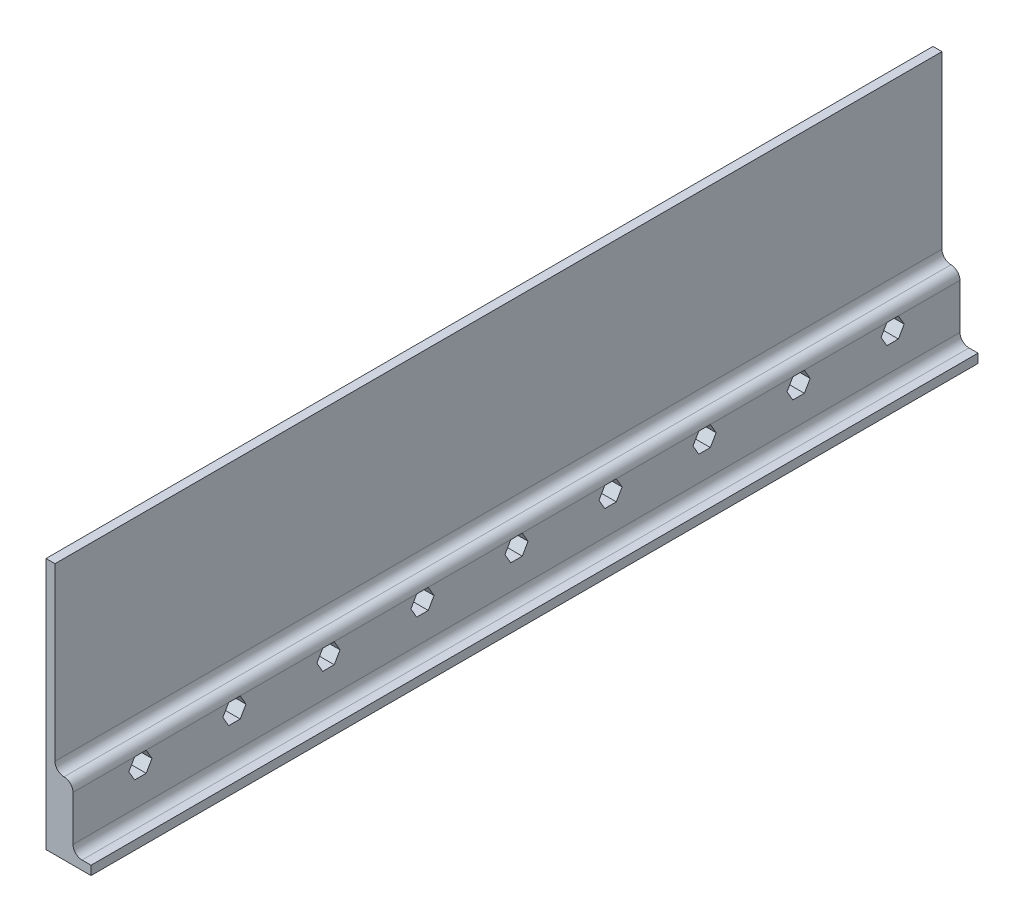
from build123d import *

# Parameters (mm, degrees)
GENERAL_EXTRUDE_DEPTH       = 925
ROUNDING_R                  = 5
ROLLER_HOLDERS_DEPTH        = 926.55388822
SKETCH5_W                   = 5
SKETCH5_H                   = 1850
GUARD_RAIL_DEPTH            = 100
GUARD_RAIL_SUPPORT_FILLET_R = 5
CUT_TO_SIZE_DEPTH           = 934.086276825
CUT_TO_SIZE_DEPTH_BACK      = 934.086276825
SKETCH6_W                   = 1357.48
SKETCH6_H                   = 140


with BuildPart() as part:
    # Sketch2 → General extrude (new, symmetric)
    with BuildSketch(Plane.XY):
        Polygon((-12.5, 20), (-12.5, -20), (12.5, -20), (12.5, -15), (2.5, -15), (2.5, 20), align=None)
    extrude(amount=GENERAL_EXTRUDE_DEPTH, both=True)

    # Rounding
    rounding_edges = [part.edges().sort_by_distance(p)[0] for p in [
        (2.5, 20, 0),
        (2.5, -15, 0),
    ]]
    fillet(rounding_edges, radius=ROUNDING_R)

    # Sketch3 → Roller holders (cut, through all)
    with BuildSketch(Plane.ZY.offset(12.5)):
        Polygon((-884.3762927, 3.8875), (-881.168390267, 9.44375), (-884.3762927, 15), (-890.792097567, 15), (-894, 9.44375), (-890.792097567, 3.8875), align=None)
        Polygon((-832.165457693, 3.8875), (-828.957555259, 9.44375), (-832.165457693, 15), (-838.581262559, 15), (-841.789164992, 9.44375), (-838.581262559, 3.8875), align=None)
        Polygon((-779.954622685, 3.8875), (-776.746720252, 9.44375), (-779.954622685, 15), (-786.370427551, 15), (-789.578329984, 9.44375), (-786.370427551, 3.8875), align=None)
        Polygon((-727.743787677, 3.8875), (-724.535885244, 9.44375), (-727.743787677, 15), (-734.159592543, 15), (-737.367494976, 9.44375), (-734.159592543, 3.8875), align=None)
        Polygon((-675.532952669, 3.8875), (-672.325050236, 9.44375), (-675.532952669, 15), (-681.948757535, 15), (-685.156659969, 9.44375), (-681.948757535, 3.8875), align=None)
        Polygon((-623.322117661, 3.8875), (-620.114215228, 9.44375), (-623.322117661, 15), (-629.737922528, 15), (-632.945824961, 9.44375), (-629.737922528, 3.8875), align=None)
        Polygon((-571.111282653, 3.8875), (-567.90338022, 9.44375), (-571.111282653, 15), (-577.52708752, 15), (-580.734989953, 9.44375), (-577.52708752, 3.8875), align=None)
        Polygon((-518.900447645, 3.8875), (-515.692545212, 9.44375), (-518.900447645, 15), (-525.316252512, 15), (-528.524154945, 9.44375), (-525.316252512, 3.8875), align=None)
        Polygon((-466.689612638, 3.8875), (-463.481710204, 9.44375), (-466.689612638, 15), (-473.105417504, 15), (-476.313319937, 9.44375), (-473.105417504, 3.8875), align=None)
        Polygon((-414.47877763, 3.8875), (-411.270875197, 9.44375), (-414.47877763, 15), (-420.894582496, 15), (-424.102484929, 9.44375), (-420.894582496, 3.8875), align=None)
        Polygon((-362.267942622, 3.8875), (-359.060040189, 9.44375), (-362.267942622, 15), (-368.683747488, 15), (-371.891649921, 9.44375), (-368.683747488, 3.8875), align=None)
        Polygon((-310.057107614, 3.8875), (-306.849205181, 9.44375), (-310.057107614, 15), (-316.47291248, 15), (-319.680814914, 9.44375), (-316.47291248, 3.8875), align=None)
        Polygon((-257.846272606, 3.8875), (-254.638370173, 9.44375), (-257.846272606, 15), (-264.262077472, 15), (-267.469979906, 9.44375), (-264.262077472, 3.8875), align=None)
        Polygon((-205.635437598, 3.8875), (-202.427535165, 9.44375), (-205.635437598, 15), (-212.051242465, 15), (-215.259144898, 9.44375), (-212.051242465, 3.8875), align=None)
        Polygon((-153.42460259, 3.8875), (-150.216700157, 9.44375), (-153.42460259, 15), (-159.840407457, 15), (-163.04830989, 9.44375), (-159.840407457, 3.8875), align=None)
        Polygon((-101.213767583, 3.8875), (-98.005865149, 9.44375), (-101.213767583, 15), (-107.629572449, 15), (-110.837474882, 9.44375), (-107.629572449, 3.8875), align=None)
        Polygon((-49.002932575, 3.8875), (-45.795030141, 9.44375), (-49.002932575, 15), (-55.418737441, 15), (-58.626639874, 9.44375), (-55.418737441, 3.8875), align=None)
        Polygon((3.207902433, 3.8875), (6.415804866, 9.44375), (3.207902433, 15), (-3.207902433, 15), (-6.415804866, 9.44375), (-3.207902433, 3.8875), align=None)
        Polygon((55.418737441, 3.8875), (58.626639874, 9.44375), (55.418737441, 15), (49.002932575, 15), (45.795030141, 9.44375), (49.002932575, 3.8875), align=None)
        Polygon((107.629572449, 3.8875), (110.837474882, 9.44375), (107.629572449, 15), (101.213767583, 15), (98.005865149, 9.44375), (101.213767583, 3.8875), align=None)
        Polygon((159.840407457, 3.8875), (163.04830989, 9.44375), (159.840407457, 15), (153.42460259, 15), (150.216700157, 9.44375), (153.42460259, 3.8875), align=None)
        Polygon((212.051242465, 3.8875), (215.259144898, 9.44375), (212.051242465, 15), (205.635437598, 15), (202.427535165, 9.44375), (205.635437598, 3.8875), align=None)
        Polygon((264.262077472, 3.8875), (267.469979906, 9.44375), (264.262077472, 15), (257.846272606, 15), (254.638370173, 9.44375), (257.846272606, 3.8875), align=None)
        Polygon((316.47291248, 3.8875), (319.680814914, 9.44375), (316.47291248, 15), (310.057107614, 15), (306.849205181, 9.44375), (310.057107614, 3.8875), align=None)
        Polygon((368.683747488, 3.8875), (371.891649921, 9.44375), (368.683747488, 15), (362.267942622, 15), (359.060040189, 9.44375), (362.267942622, 3.8875), align=None)
        Polygon((420.894582496, 3.8875), (424.102484929, 9.44375), (420.894582496, 15), (414.47877763, 15), (411.270875197, 9.44375), (414.47877763, 3.8875), align=None)
        Polygon((473.105417504, 3.8875), (476.313319937, 9.44375), (473.105417504, 15), (466.689612638, 15), (463.481710204, 9.44375), (466.689612638, 3.8875), align=None)
        Polygon((525.316252512, 3.8875), (528.524154945, 9.44375), (525.316252512, 15), (518.900447645, 15), (515.692545212, 9.44375), (518.900447645, 3.8875), align=None)
        Polygon((577.52708752, 3.8875), (580.734989953, 9.44375), (577.52708752, 15), (571.111282653, 15), (567.90338022, 9.44375), (571.111282653, 3.8875), align=None)
        Polygon((629.737922528, 3.8875), (632.945824961, 9.44375), (629.737922528, 15), (623.322117661, 15), (620.114215228, 9.44375), (623.322117661, 3.8875), align=None)
        Polygon((681.948757535, 3.8875), (685.156659969, 9.44375), (681.948757535, 15), (675.532952669, 15), (672.325050236, 9.44375), (675.532952669, 3.8875), align=None)
        Polygon((734.159592543, 3.8875), (737.367494976, 9.44375), (734.159592543, 15), (727.743787677, 15), (724.535885244, 9.44375), (727.743787677, 3.8875), align=None)
        Polygon((786.370427551, 3.8875), (789.578329984, 9.44375), (786.370427551, 15), (779.954622685, 15), (776.746720252, 9.44375), (779.954622685, 3.8875), align=None)
        Polygon((838.581262559, 3.8875), (841.789164992, 9.44375), (838.581262559, 15), (832.165457693, 15), (828.957555259, 9.44375), (832.165457693, 3.8875), align=None)
        Polygon((890.792097567, 3.8875), (894, 9.44375), (890.792097567, 15), (884.3762927, 15), (881.168390267, 9.44375), (884.3762927, 3.8875), align=None)
    extrude(amount=-ROLLER_HOLDERS_DEPTH, mode=Mode.SUBTRACT)

    # Sketch5 → Guard rail (add)
    with BuildSketch(Plane(origin=(0, 20, 0), x_dir=(1, 0, 0), z_dir=(0, 1, 0))):
        with Locations((-10, 0)):
            Rectangle(SKETCH5_W, SKETCH5_H)
    extrude(amount=GUARD_RAIL_DEPTH)

    # Guard rail support fillet
    guard_rail_support_fillet_edges = [part.edges().sort_by_distance(p)[0] for p in [
        (-7.5, 20, 0),
    ]]
    fillet(guard_rail_support_fillet_edges, radius=GUARD_RAIL_SUPPORT_FILLET_R - 0.0001)  # a hair under: the kernel refuses the full size

    # Sketch6 → CUT TO SIZE (cut, two sides: drawn at the far end of the back side and taken through both)
    with BuildSketch(Plane.ZY.offset(12.5).offset(-CUT_TO_SIZE_DEPTH_BACK)):
        with Locations((-246.26, 50)):
            Rectangle(SKETCH6_W, SKETCH6_H)
    extrude(amount=CUT_TO_SIZE_DEPTH + CUT_TO_SIZE_DEPTH_BACK, mode=Mode.SUBTRACT)


solid = part.part
